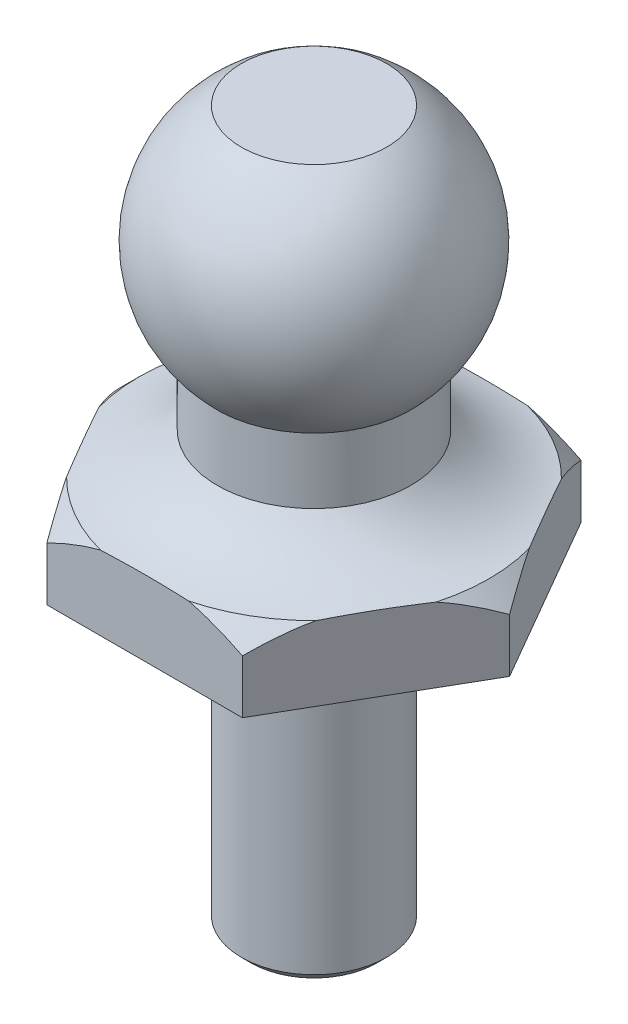
from build123d import *

# Parameters (mm, degrees)
CHANFREIN1_SIZE         = 0.4
ESQUISSE2_OUTSIDE_W     = 13.828
ESQUISSE2_OUTSIDE_H     = 13.828
ENL_V_MAT_EXTRU_1_DEPTH = 11.002249747
CHANFREIN2_SIZE         = 0.2
CONG_2_R                = 0.1


with BuildPart() as part:
    # Esquisse1 → Révolution1 (revolve)
    with BuildSketch(Plane.XY, mode=Mode.PRIVATE) as r_volution1_sk:
        with BuildLine():
            Line((0, -6.5), (-1.5, -6.5))
            Line((-1.5, -6.5), (-1.5, 0))
            Line((-1.5, 0), (-4.05, 0))
            Line((-4.05, 0), (-4.05, 1.5))
            ThreePointArc((-4.05, 1.5), (-2.931315388, 1.73386291), (-2, 2.396281786))
            Line((-2, 2.396281786), (-2, 3.746281786))
            ThreePointArc((-2, 3.746281786), (-2.832207881, 6.094635769), (-1.5, 8.2))
            Line((-1.5, 8.2), (0, 8.2))
            Line((0, 8.2), (0, -6.5))
        make_face()
    revolve(r_volution1_sk.sketch.rotate(Axis((0, -9.21016139, 0), (0, 1, 0)), 270), axis=Axis((0, -9.21016139, 0), (0, 1, 0)))

    # Chanfrein1
    # the kernel refuses this chamfer: 0.4 mm, written as the material it takes off along each edge
    with BuildSketch(Plane(origin=(0, 1.5, 0), x_dir=(0, 0, -1), z_dir=(1, 0, 0))) as chanfrein1_piece_1:
        with BuildLine():
            Line((4.05, -CHANFREIN1_SIZE), (3.616082015, 0.033917985))
            ThreePointArc((3.616082015, 0.033917985), (3.826287877, 0.008975254), (4.05, 0))
            Line((4.05, 0), (4.05, -CHANFREIN1_SIZE))
        make_face()
    revolve(axis=Axis((0, 1.5, 0), (0, 1, 0)), mode=Mode.SUBTRACT)

    # Esquisse2 outside → Enlèv. mat.-Extru.1 (cut, through all)
    with BuildSketch(Plane.XZ):
        Rectangle(ESQUISSE2_OUTSIDE_W, ESQUISSE2_OUTSIDE_H)
        Polygon((2.020725942, 3.5), (-2.020725942, 3.5), (-4.041451884, 0), (-2.020725942, -3.5), (2.020725942, -3.5), (4.041451884, 0), align=None, mode=Mode.SUBTRACT)
    extrude(amount=-ENL_V_MAT_EXTRU_1_DEPTH, mode=Mode.SUBTRACT)

    # Chanfrein2
    chanfrein2_edges = [part.edges().sort_by_distance(p)[0] for p in [
        (0, -6.5, 1.5),
    ]]
    chamfer(chanfrein2_edges, length=CHANFREIN2_SIZE)

    # Congé2
    cong_2_edges = [part.edges().sort_by_distance(p)[0] for p in [
        (0, 0, 1.5),
    ]]
    fillet(cong_2_edges, radius=CONG_2_R)


solid = part.part
